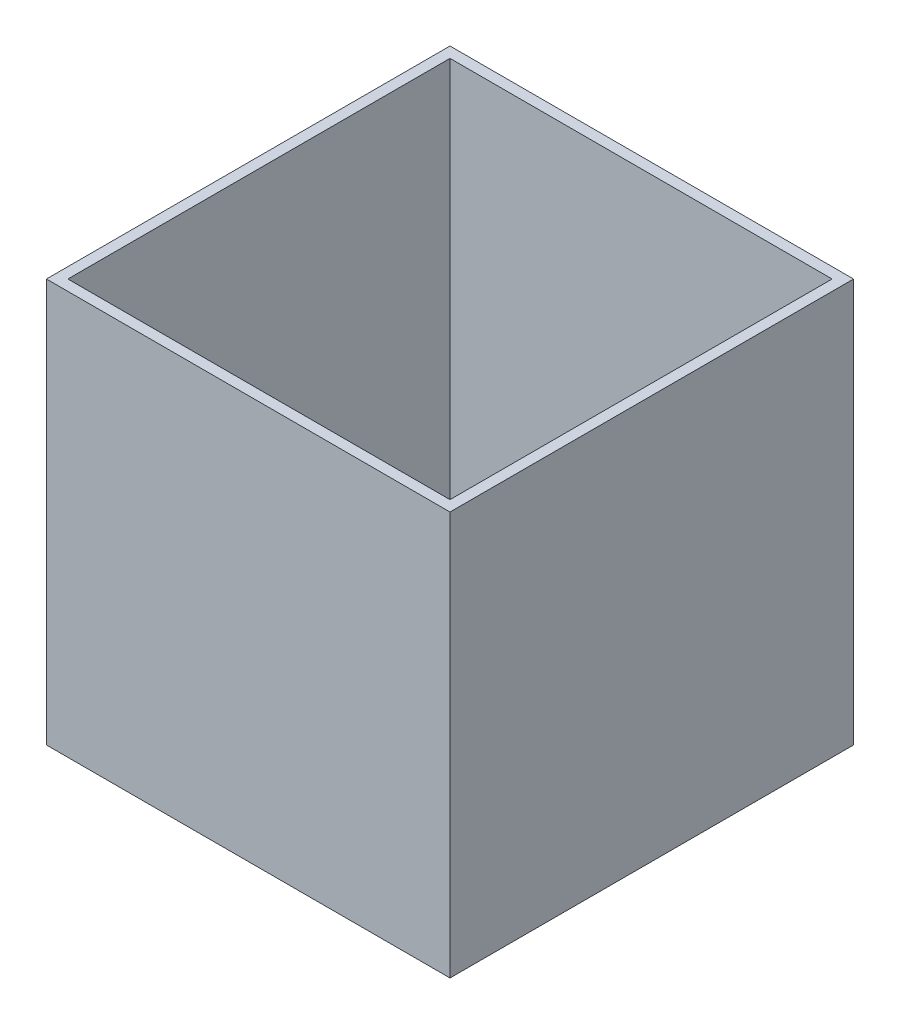
from build123d import *

# Parameters (mm, degrees)
SKETCH2_W           = 113
SKETCH2_H           = 113
BOSS_EXTRUDE1_DEPTH = 113
SHELL1_T            = -3


with BuildPart() as part:
    # Sketch2 → Boss-Extrude1 (new body)
    with BuildSketch(Plane(origin=(0, 0, 0), x_dir=(1, 0, 0), z_dir=(0, 1, 0))):
        Rectangle(SKETCH2_W, SKETCH2_H)
    extrude(amount=BOSS_EXTRUDE1_DEPTH)

    # Shell1
    shell1_openings = [part.faces().sort_by_distance(p)[0] for p in [
        (0, 113, 0),
    ]]
    offset(amount=SHELL1_T, openings=shell1_openings, kind=Kind.INTERSECTION)


solid = part.part
